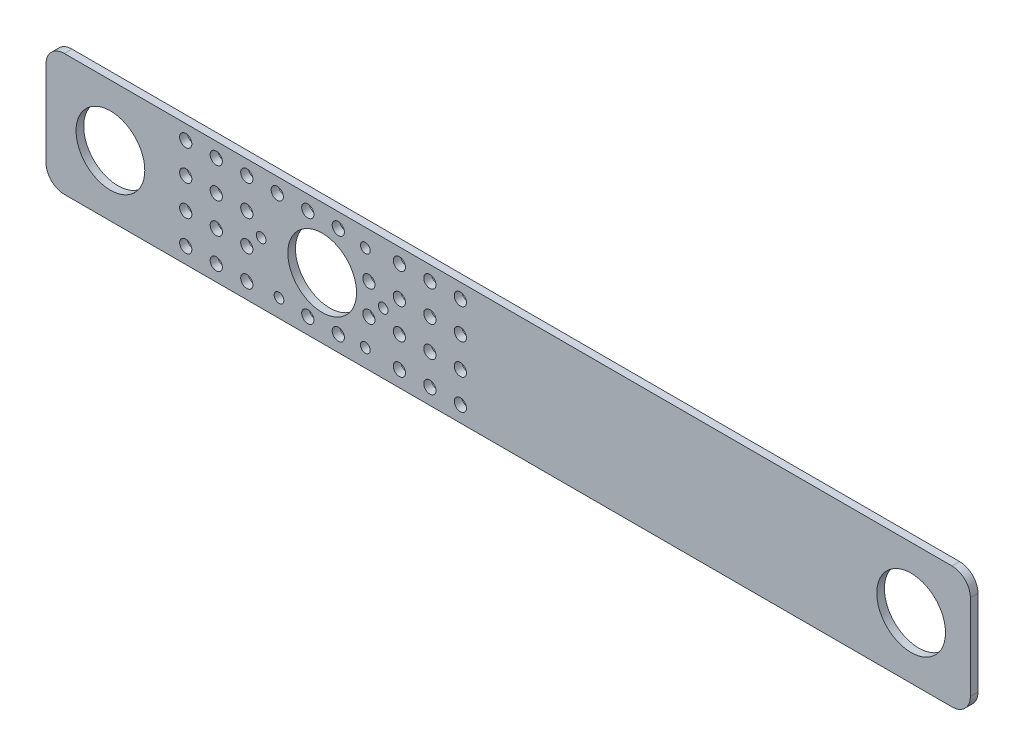
from build123d import *

# Parameters (mm, degrees)
SKETCH1_W           = 384.714130078
SKETCH1_H           = 50.8
SKETCH1_R           = 14.3002
SKETCH1_R_2         = 2.0193
SKETCH1_R_3         = 2.54
BOSS_EXTRUDE1_DEPTH = 3.175
FILLET1_R           = 7.62


with BuildPart() as part:
    # Sketch1 → Boss-Extrude1 (new body)
    with BuildSketch(Plane.XY):
        with Locations((91.437616825, 0.672961839)):
            Rectangle(SKETCH1_W, SKETCH1_H)
        with Locations((-74.109858368, 0.672961839)):
            Circle(SKETCH1_R, mode=Mode.SUBTRACT)
        with Locations((14.028141632, 0.672961839)):
            Circle(SKETCH1_R, mode=Mode.SUBTRACT)
        with Locations((259.138141632, 0.672961839)):
            Circle(SKETCH1_R, mode=Mode.SUBTRACT)
        with Locations((39.42236813, 0.662961839)):
            Circle(SKETCH1_R_2, mode=Mode.SUBTRACT)
        with Locations((31.982880372, -17.297550403)):
            Circle(SKETCH1_R_2, mode=Mode.SUBTRACT)
        with Locations((-3.938144112, -17.297550403)):
            Circle(SKETCH1_R_2, mode=Mode.SUBTRACT)
        with Locations((31.982880372, 18.623474081)):
            Circle(SKETCH1_R_2, mode=Mode.SUBTRACT)
        with Locations((-11.37763187, 0.662961839)):
            Circle(SKETCH1_R_2, mode=Mode.SUBTRACT)
        with Locations((-30.055260848, 7.289574438)):
            Circle(SKETCH1_R_3, mode=Mode.SUBTRACT)
        with Locations((-30.055260848, -5.410425562)):
            Circle(SKETCH1_R_3, mode=Mode.SUBTRACT)
        with Locations((-17.355260848, 7.289574438)):
            Circle(SKETCH1_R_3, mode=Mode.SUBTRACT)
        with Locations((-17.355260848, -5.410425562)):
            Circle(SKETCH1_R_3, mode=Mode.SUBTRACT)
        with Locations((-17.355260848, -18.110425562)):
            Circle(SKETCH1_R_3, mode=Mode.SUBTRACT)
        with Locations((-17.355260848, 19.989574438)):
            Circle(SKETCH1_R_3, mode=Mode.SUBTRACT)
        with Locations((-30.066807854, 19.989574438)):
            Circle(SKETCH1_R_3, mode=Mode.SUBTRACT)
        with Locations((33.444739152, -5.410425562)):
            Circle(SKETCH1_R_3, mode=Mode.SUBTRACT)
        with Locations((33.444739152, 7.289574438)):
            Circle(SKETCH1_R_3, mode=Mode.SUBTRACT)
        with Locations((58.844739152, -5.410425562)):
            Circle(SKETCH1_R_3, mode=Mode.SUBTRACT)
        with Locations((58.844739152, 7.289574438)):
            Circle(SKETCH1_R_3, mode=Mode.SUBTRACT)
        with Locations((46.144739152, 7.289574438)):
            Circle(SKETCH1_R_3, mode=Mode.SUBTRACT)
        with Locations((46.144739152, -5.410425562)):
            Circle(SKETCH1_R_3, mode=Mode.SUBTRACT)
        with Locations((46.144739152, -18.110425562)):
            Circle(SKETCH1_R_3, mode=Mode.SUBTRACT)
        with Locations((58.833192146, -18.110425562)):
            Circle(SKETCH1_R_3, mode=Mode.SUBTRACT)
        with Locations((71.533192146, -18.110425562)):
            Circle(SKETCH1_R_3, mode=Mode.SUBTRACT)
        with Locations((71.533192146, -5.410425562)):
            Circle(SKETCH1_R_3, mode=Mode.SUBTRACT)
        with Locations((71.533192146, 7.289574438)):
            Circle(SKETCH1_R_3, mode=Mode.SUBTRACT)
        with Locations((71.533192146, 19.989574438)):
            Circle(SKETCH1_R_3, mode=Mode.SUBTRACT)
        with Locations((58.833192146, 19.989574438)):
            Circle(SKETCH1_R_3, mode=Mode.SUBTRACT)
        with Locations((46.144739152, 19.989574438)):
            Circle(SKETCH1_R_3, mode=Mode.SUBTRACT)
        with Locations((20.733192146, 19.989574438)):
            Circle(SKETCH1_R_3, mode=Mode.SUBTRACT)
        with Locations((8.033192146, 19.989574438)):
            Circle(SKETCH1_R_3, mode=Mode.SUBTRACT)
        with Locations((-4.666807854, 19.989574438)):
            Circle(SKETCH1_R_3, mode=Mode.SUBTRACT)
        with Locations((20.733192146, -18.110425562)):
            Circle(SKETCH1_R_3, mode=Mode.SUBTRACT)
        with Locations((8.033192146, -18.110425562)):
            Circle(SKETCH1_R_3, mode=Mode.SUBTRACT)
        with Locations((-30.066807854, -18.110425562)):
            Circle(SKETCH1_R_3, mode=Mode.SUBTRACT)
        with Locations((-42.766807854, -18.110425562)):
            Circle(SKETCH1_R_3, mode=Mode.SUBTRACT)
        with Locations((-42.766807854, 19.989574438)):
            Circle(SKETCH1_R_3, mode=Mode.SUBTRACT)
        with Locations((-42.766807854, 7.289574438)):
            Circle(SKETCH1_R_3, mode=Mode.SUBTRACT)
        with Locations((-42.766807854, -5.410425562)):
            Circle(SKETCH1_R_3, mode=Mode.SUBTRACT)
    extrude(amount=BOSS_EXTRUDE1_DEPTH)

    # Fillet1
    fillet1_edges = [part.edges().sort_by_distance(p)[0] for p in [
        (283.794681864, -24.727038161, 1.5875),
        (283.794681864, 26.072961839, 1.5875),
        (-100.919448214, -24.727038161, 1.5875),
        (-100.919448214, 26.072961839, 1.5875),
    ]]
    fillet(fillet1_edges, radius=FILLET1_R)


solid = part.part
